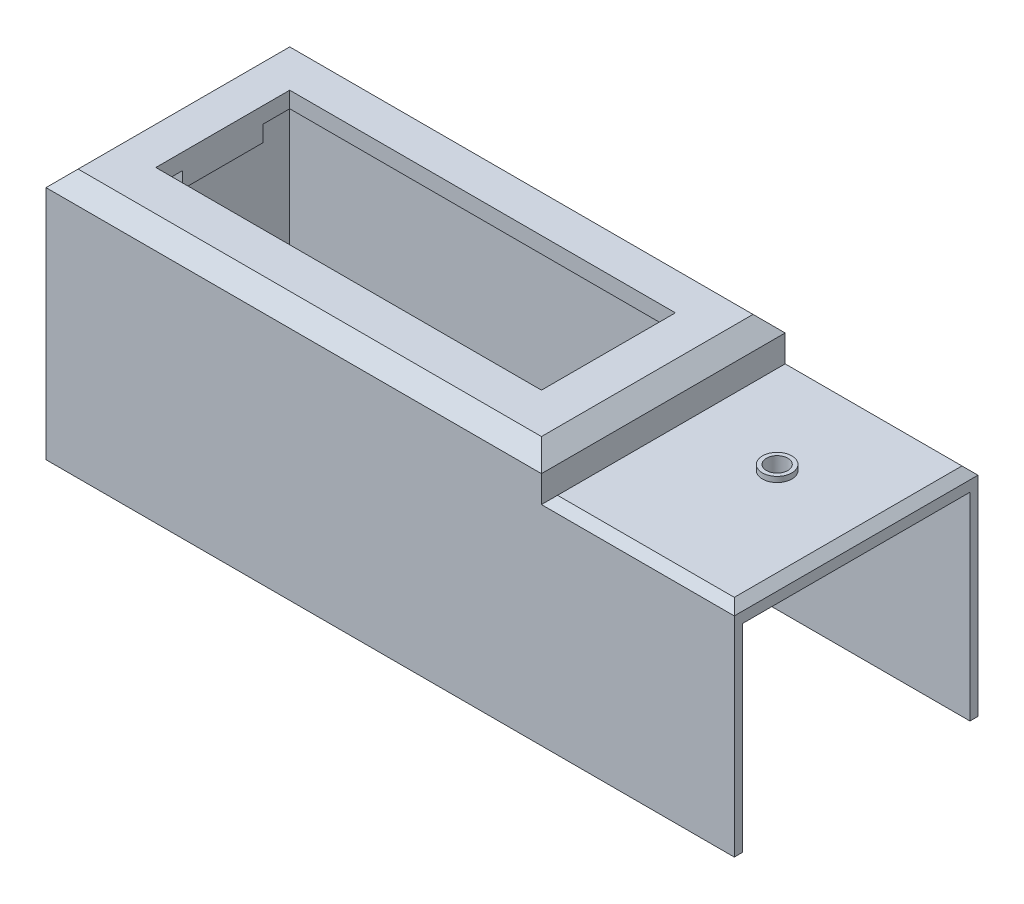
from build123d import *

# Parameters (mm, degrees)
TOP_EDGE_OUTLINE_W  = 86.5
TOP_EDGE_OUTLINE_H  = 39.5
TOP_EDGE_DEPTH      = 3
TOP_EDGE_DRAFT      = 45
SKETCH13_W          = 72
SKETCH13_H          = 25
DISPLAY_HOLE_DEPTH  = 6
SKETCH14_W          = 92.5
SKETCH14_H          = 45.5
SKETCH14_W_2        = 89.5
SKETCH14_H_2        = 42.5
BOSS_EXTRUDE5_DEPTH = 5
SKETCH15_W          = 128.5
SKETCH15_H          = 45.5
SKETCH15_W_2        = 89.5
SKETCH15_H_2        = 42.5
BOSS_EXTRUDE6_DEPTH = 2
SKETCH16_W          = 128.5
SKETCH16_H          = 45.5
SKETCH16_W_2        = 125.5
SKETCH16_H_2        = 42.5
BOSS_EXTRUDE7_DEPTH = 37
LOFT2_OUTLINE_W     = 33
LOFT2_OUTLINE_H     = 42.5
LOFT2_DEPTH         = 1.5
LOFT2_DRAFT         = 45
SKETCH19_R          = 2.75
SKETCH19_R_2        = 2
BOSS_EXTRUDE8_DEPTH = 1
CUT_EXTRUDE3_START  = -11
SKETCH20_R          = 2
CUT_EXTRUDE3_DEPTH  = 11
SKETCH21_W          = 12
SKETCH21_H          = 8
CUT_EXTRUDE4_DEPTH  = 11
SKETCH22_W          = 4
SKETCH22_H          = 15
BOSS_EXTRUDE9_DEPTH = 3
SKETCH24_W          = 42.5
SKETCH24_H          = 37
CUT_EXTRUDE5_DEPTH  = 17


# Read off the part's stored shape, not the designer's step: Top Edge, Loft2
with BuildPart() as part:
    # Top Edge outline → Top Edge (with draft: the straight prism first)
    with BuildSketch(Plane(origin=(0, 0, 0), x_dir=(1, 0, 0), z_dir=(0, 1, 0))):
        with Locations((0.25, -0.25)):
            Rectangle(TOP_EDGE_OUTLINE_W, TOP_EDGE_OUTLINE_H)
    extrude(amount=-TOP_EDGE_DEPTH)
    # Top Edge: the draft: its side faces are tilted about the plane it starts from
    top_edge_sides = [part.faces().sort_by_distance(p)[0] for p in [
        (-43, -1.5, 0.25),
        (0.25, -1.5, 20),
        (43.5, -1.5, 0.25),
        (0.25, -1.5, -19.5),
    ]]
    draft(top_edge_sides, Plane(origin=(0, 0, 0), x_dir=(1, 0, 0), z_dir=(0, 1, 0)), TOP_EDGE_DRAFT)

    # Sketch13 → Display Hole (cut)
    with BuildSketch(Plane(origin=(0, 0, 0), x_dir=(1, 0, 0), z_dir=(0, 1, 0))):
        Rectangle(SKETCH13_W, SKETCH13_H)
    extrude(amount=-DISPLAY_HOLE_DEPTH, mode=Mode.SUBTRACT)

    # Sketch14 → Boss-Extrude5 (add)
    with BuildSketch(Plane.XZ.offset(3)):
        with Locations((0.25, 0.25)):
            Rectangle(SKETCH14_W, SKETCH14_H)
        with Locations((0.25, 0.25)):
            Rectangle(SKETCH14_W_2, SKETCH14_H_2, mode=Mode.SUBTRACT)
    extrude(amount=BOSS_EXTRUDE5_DEPTH)

    # Sketch15 → Boss-Extrude6 (add)
    with BuildSketch(Plane.XZ.offset(8)):
        with Locations((18.25, 0.25)):
            Rectangle(SKETCH15_W, SKETCH15_H)
        with Locations((0.25, 0.25)):
            Rectangle(SKETCH15_W_2, SKETCH15_H_2, mode=Mode.SUBTRACT)
    extrude(amount=BOSS_EXTRUDE6_DEPTH)

    # Sketch16 → Boss-Extrude7 (add)
    with BuildSketch(Plane.XZ.offset(10)):
        with Locations((18.25, 0.25)):
            Rectangle(SKETCH16_W, SKETCH16_H)
        with Locations((18.25, 0.25)):
            Rectangle(SKETCH16_W_2, SKETCH16_H_2, mode=Mode.SUBTRACT)
    extrude(amount=BOSS_EXTRUDE7_DEPTH)


with BuildPart() as loft2_tool:
    # Loft2 outline → Loft2 (with draft: the straight prism first)
    with BuildSketch(Plane(origin=(0, -6.5, 0), x_dir=(1, 0, 0), z_dir=(0, 1, 0))):
        with Locations((64.5, -0.25)):
            Rectangle(LOFT2_OUTLINE_W, LOFT2_OUTLINE_H)
    extrude(amount=-LOFT2_DEPTH)
    # Loft2: the draft: its side faces are tilted about the plane it starts from
    loft2_sides = [loft2_tool.faces().sort_by_distance(p)[0] for p in [
        (81, -7.25, 0.25),
        (64.5, -7.25, -21),
        (48, -7.25, 0.25),
        (64.5, -7.25, 21.5),
    ]]
    draft(loft2_sides, Plane(origin=(0, -6.5, 0), x_dir=(1, 0, 0), z_dir=(0, 1, 0)), LOFT2_DRAFT)


with BuildPart() as part_1:
    add(part.part)

    # Loft2: add loft2_tool
    add(loft2_tool.part)

    # Sketch19 → Boss-Extrude8 (add)
    with BuildSketch(Plane(origin=(0, -6.5, 0), x_dir=(1, 0, 0), z_dir=(0, 1, 0))):
        with Locations(Location((64.5, 3, 0), (0, 0, 270))):
            Circle(SKETCH19_R)
        with Locations(Location((64.5, 3, 0), (0, 0, 270))):
            Circle(SKETCH19_R_2, mode=Mode.SUBTRACT)
    extrude(amount=BOSS_EXTRUDE8_DEPTH)

    # Sketch20 → Cut-Extrude3 (cut)
    with BuildSketch(Plane(origin=(0, -6.5, 0), x_dir=(1, 0, 0), z_dir=(0, 1, 0)).offset(CUT_EXTRUDE3_START)):
        with Locations(Location((64.5, 3, 0), (0, 0, 90))):
            Circle(SKETCH20_R)
    extrude(amount=CUT_EXTRUDE3_DEPTH, mode=Mode.SUBTRACT)

    # Sketch21 → Cut-Extrude4 (cut)
    with BuildSketch(Plane(origin=(82.5, 0, 0), x_dir=(0, 0, -1), z_dir=(1, 0, 0))):
        with Locations((0, -43)):
            Rectangle(SKETCH21_W, SKETCH21_H)
    extrude(amount=-CUT_EXTRUDE4_DEPTH, mode=Mode.SUBTRACT)

    # Sketch22 → Boss-Extrude9 (add)
    with BuildSketch(Plane.XZ.offset(3)):
        with Locations((-38, 0)):
            Rectangle(SKETCH22_W, SKETCH22_H)
    extrude(amount=BOSS_EXTRUDE9_DEPTH)

    # Sketch24 → Cut-Extrude5 (cut)
    with BuildSketch(Plane.ZY.offset(-81)):
        with Locations((0.25, -28.5)):
            Rectangle(SKETCH24_W, SKETCH24_H)
    extrude(amount=-CUT_EXTRUDE5_DEPTH, mode=Mode.SUBTRACT)


solid = part_1.part
